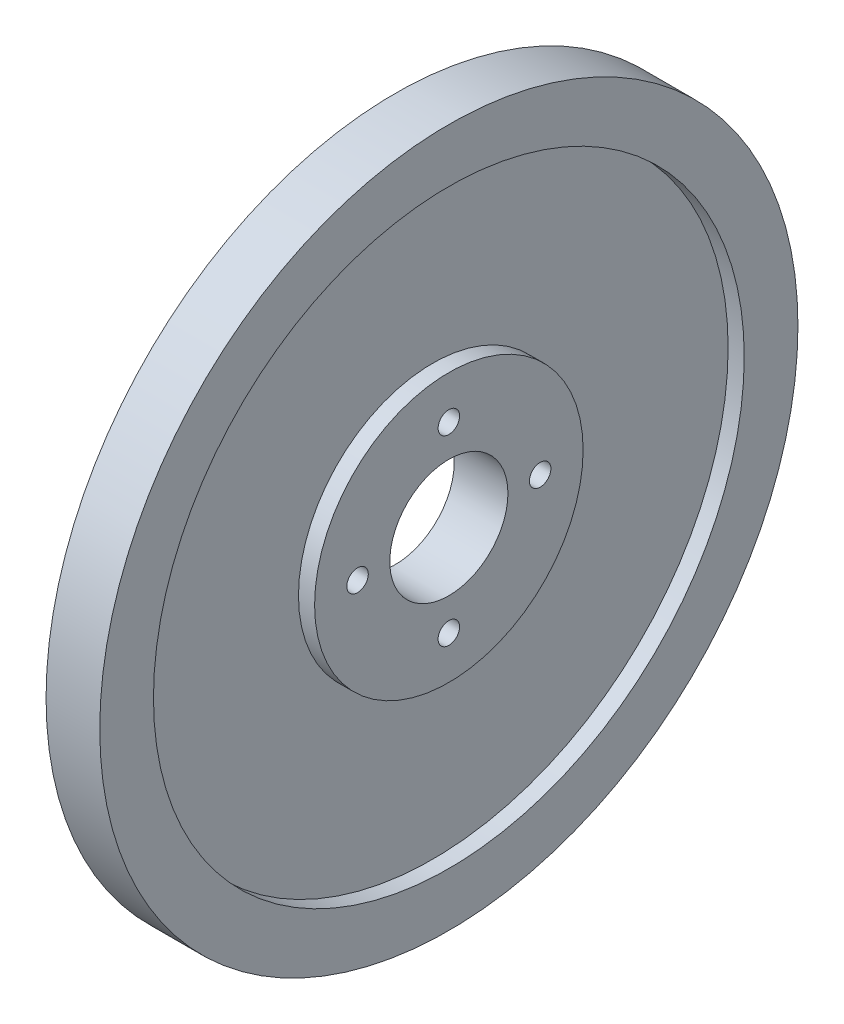
from build123d import *

# Parameters (mm, degrees)
SKETCH1_R           = 65
BOSS_EXTRUDE1_DEPTH = 5
SKETCH3_R           = 11
CUT_EXTRUDE2_DEPTH  = 93.466210045
SKETCH5_R           = 2
CUT_EXTRUDE5_DEPTH  = 93.466210045
SKETCH9_R           = 55
SKETCH9_R_2         = 25
CUT_EXTRUDE7_DEPTH  = 3


with BuildPart() as part:
    # Sketch1 → Boss-Extrude1 (new, symmetric)
    with BuildSketch(Plane(origin=(0, 0, 0), x_dir=(0, 0, -1), z_dir=(1, 0, 0))):
        Circle(SKETCH1_R)
    extrude(amount=BOSS_EXTRUDE1_DEPTH, both=True)

    # Sketch3 → Cut-Extrude2 (cut, through all)
    with BuildSketch(Plane(origin=(5, 0, 0), x_dir=(0, 0, -1), z_dir=(1, 0, 0))):
        Circle(SKETCH3_R)
    extrude(amount=-CUT_EXTRUDE2_DEPTH, mode=Mode.SUBTRACT)

    # Sketch5 → Cut-Extrude5 (cut, through all)
    with BuildSketch(Plane(origin=(5, 0, 0), x_dir=(0, 0, -1), z_dir=(1, 0, 0))):
        with Locations((0, 17)):
            Circle(SKETCH5_R)
        with Locations((-17, 0)):
            Circle(SKETCH5_R)
        with Locations((0, -17)):
            Circle(SKETCH5_R)
        with Locations((17, 0)):
            Circle(SKETCH5_R)
    extrude(amount=-CUT_EXTRUDE5_DEPTH, mode=Mode.SUBTRACT)

    # Sketch9 → Cut-Extrude7 (cut)
    with BuildSketch(Plane(origin=(5, 0, 0), x_dir=(0, 0, -1), z_dir=(1, 0, 0))):
        Circle(SKETCH9_R)
        Circle(SKETCH9_R_2, mode=Mode.SUBTRACT)
    cut_extrude7 = extrude(amount=-CUT_EXTRUDE7_DEPTH, mode=Mode.SUBTRACT)

    # Mirror2: Cut-Extrude7 across plane
    add(cut_extrude7.mirror(Plane(origin=(0, 0, 0), x_dir=(0, 0, 1), z_dir=(1, 0, 0))), mode=Mode.SUBTRACT)


solid = part.part
